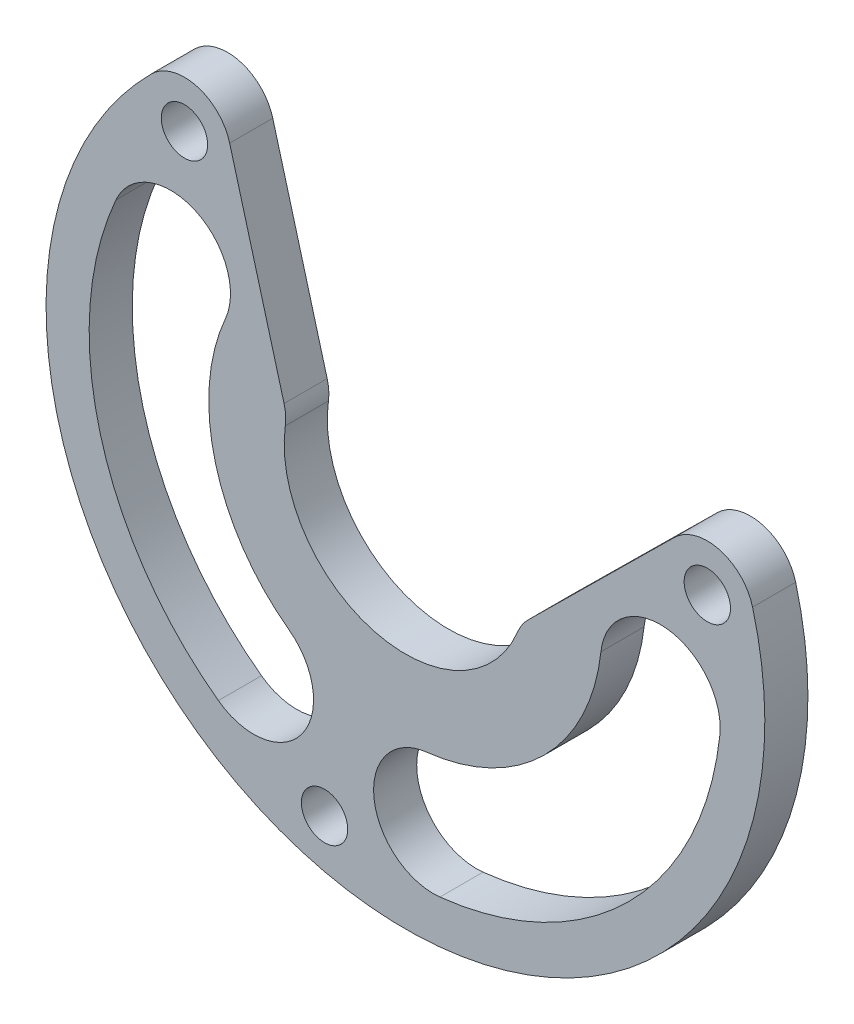
from build123d import *

# Parameters (mm, degrees)
SKETCH1_R           = 2.15
BOSS_EXTRUDE1_DEPTH = 4


with BuildPart() as part:
    # Sketch1 → Boss-Extrude1 (new body)
    with BuildSketch(Plane.XY):
        with BuildLine():
            Line((169.071208826, 34.599951739), (155.49789847, 21.187541922))
            ThreePointArc((155.49789847, 21.187541922), (154.94043739, 20.512931345), (154.52928773, 19.740391219))
            ThreePointArc((154.52928773, 19.740391219), (141.205165824, 13.133334454), (132.969666153, 25.51727441))
            ThreePointArc((132.969666153, 25.51727441), (132.999870165, 26.391888614), (132.854399997, 27.254849052))
            Line((132.854399997, 27.254849052), (127.805773323, 45.656991858))
            ThreePointArc((127.805773323, 45.656991858), (124.72411503, 48.711211723), (120.534868929, 47.582011153))
            ThreePointArc((120.534868929, 47.582011153), (135.485264927, -8.213626307), (176.330506388, 32.631615154))
            ThreePointArc((176.330506388, 32.631615154), (173.267113127, 35.704154585), (169.071208826, 34.599951739))
        make_face()
        with Locations((123.610783427, 44.506096654)):
            Circle(SKETCH1_R, mode=Mode.SUBTRACT)
        with Locations((172.128729044, 31.505752308)):
            Circle(SKETCH1_R, mode=Mode.SUBTRACT)
        with Locations((136.611127773, -4.011848962)):
            Circle(SKETCH1_R, mode=Mode.SUBTRACT)
        with BuildLine():
            ThreePointArc((127.410923425, 31.346666741), (124.564673615, 38.661300157), (117.250040198, 35.815050347))
            ThreePointArc((117.250040198, 35.815050347), (115.76695708, 16.403661026), (126.757039397, 0.334446311))
            ThreePointArc((126.757039397, 0.334446311), (134.51482266, 1.526838378), (133.322430592, 9.284621641))
            ThreePointArc((133.322430592, 9.284621641), (126.488733751, 19.276552427), (127.410923425, 31.346666741))
        make_face(mode=Mode.SUBTRACT)
        with BuildLine():
            ThreePointArc((173.291771113, 20.798713806), (168.38023766, 26.920955155), (162.25799631, 22.009421702))
            ThreePointArc((162.25799631, 22.009421702), (157.021578838, 11.095301243), (146.107458379, 5.858883771))
            ThreePointArc((146.107458379, 5.858883771), (141.195924926, -0.263357578), (147.318166275, -5.174891032))
            ThreePointArc((147.318166275, -5.174891032), (164.870464109, 3.246415972), (173.291771113, 20.798713806))
        make_face(mode=Mode.SUBTRACT)
    extrude(amount=BOSS_EXTRUDE1_DEPTH)


solid = part.part
